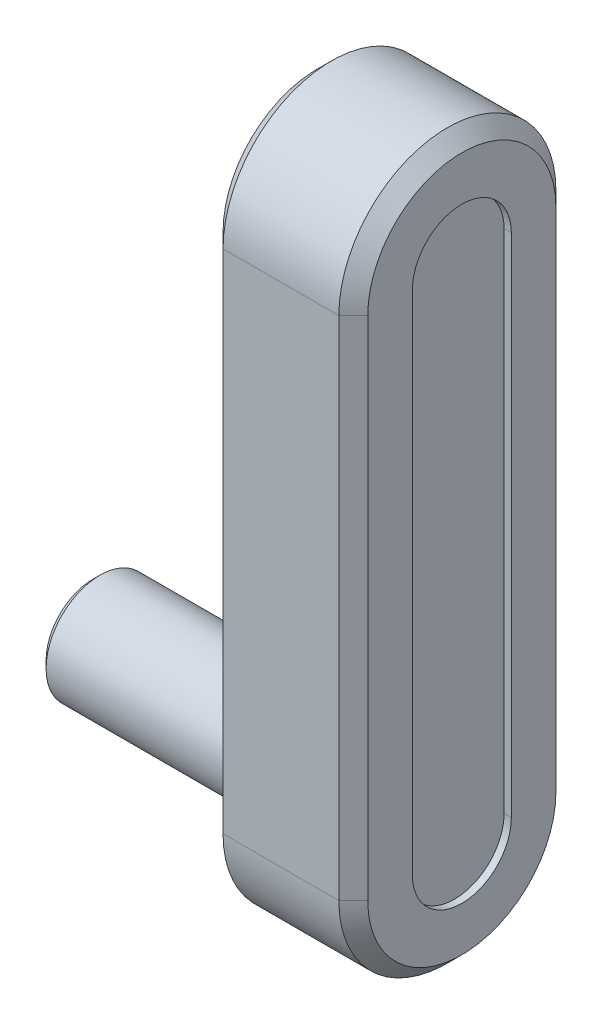
from build123d import *

# Parameters (mm, degrees)
SKETCH_1_R          = 4.9
EXTRUDE_1_DEPTH     = 10
EXTRUDE_2_DEPTH     = 20
SKETCH_3_R          = 7.45
EXTRUDE_3_DEPTH     = 31
CHAMFER_1_SIZE      = 2
CUT_EXTRUDE_1_DEPTH = 1
SKETCH_5_R          = 4.9
CUT_EXTRUDE_2_DEPTH = 25
SKETCH_9_R          = 10
EXTRUDE_4_DEPTH     = 1
CHAMFER_2_SIZE      = 1
CHAMFER_4_SIZE      = 1
CHAMFER_5_SIZE      = 1


with BuildPart() as part:
    # 草图1 → 凸台-拉伸1 (new body)
    with BuildSketch(Plane(origin=(0, 0, 0), x_dir=(0, 0, -1), z_dir=(1, 0, 0))):
        Circle(SKETCH_1_R)
    extrude(amount=EXTRUDE_1_DEPTH)

    # 草图2 → 凸台-拉伸2 (add)
    with BuildSketch(Plane(origin=(10, 0, 0), x_dir=(0, 0, -1), z_dir=(1, 0, 0))):
        with BuildLine():
            Line((15, 0), (15, -70))
            ThreePointArc((15, -70), (0, -85), (-15, -70))
            Line((-15, -70), (-15, 0))
            ThreePointArc((-15, 0), (0, 15), (15, 0))
        make_face()
    extrude(amount=EXTRUDE_2_DEPTH)

    # 草图3 → 凸台-拉伸3 (add)
    with BuildSketch(Plane.ZY.offset(-10)):
        with Locations(Location((0, -70, 0), (0, 0, 180))):
            Circle(SKETCH_3_R)
    extrude(amount=EXTRUDE_3_DEPTH)

    # 倒角1
    chamfer_1_edges = [part.edges().sort_by_distance(p)[0] for p in [
        (10, -35, 15),
        (10, -85, 0),
        (30, -35, -15),
        (10, 15, 0),
        (30, -35, 15),
        (30, -85, 0),
        (30, 15, 0),
        (10, -35, -15),
    ]]
    chamfer(chamfer_1_edges, length=CHAMFER_1_SIZE)

    # 草图4 → 切除-拉伸1 (cut)
    with BuildSketch(Plane(origin=(30, 0, 0), x_dir=(0, 0, -1), z_dir=(1, 0, 0))):
        with BuildLine():
            Line((6.835634275, 0), (6.835634275, -70))
            ThreePointArc((6.835634275, -70), (0, -76.835634275), (-6.835634275, -70))
            Line((-6.835634275, -70), (-6.835634275, 0))
            ThreePointArc((-6.835634275, 0), (0, 6.835634275), (6.835634275, 0))
        make_face()
    extrude(amount=-CUT_EXTRUDE_1_DEPTH, mode=Mode.SUBTRACT)

    # 草图5 → 切除-拉伸2 (cut)
    with BuildSketch(Plane.ZY):
        Circle(SKETCH_5_R)
    extrude(amount=-CUT_EXTRUDE_2_DEPTH, mode=Mode.SUBTRACT)

    # 草图9 → 凸台-拉伸4 (add)
    with BuildSketch(Plane.ZY.offset(-10)):
        with Locations(Location((0, -70, 0), (0, 0, 180))):
            Circle(SKETCH_9_R)
    extrude(amount=EXTRUDE_4_DEPTH)

    # 倒角2
    chamfer_2_edges = [part.edges().sort_by_distance(p)[0] for p in [
        (9, -70, 10),
    ]]
    chamfer(chamfer_2_edges, length=CHAMFER_2_SIZE - 0.0001)  # a hair under: the kernel refuses the full size

    # 倒角4
    chamfer_4_edges = [part.edges().sort_by_distance(p)[0] for p in [
        (10, 0, -4.9),
    ]]
    chamfer(chamfer_4_edges, length=CHAMFER_4_SIZE)

    # 倒角5
    chamfer_5_edges = [part.edges().sort_by_distance(p)[0] for p in [
        (-21, -70, 7.45),
    ]]
    chamfer(chamfer_5_edges, length=CHAMFER_5_SIZE)


solid = part.part
